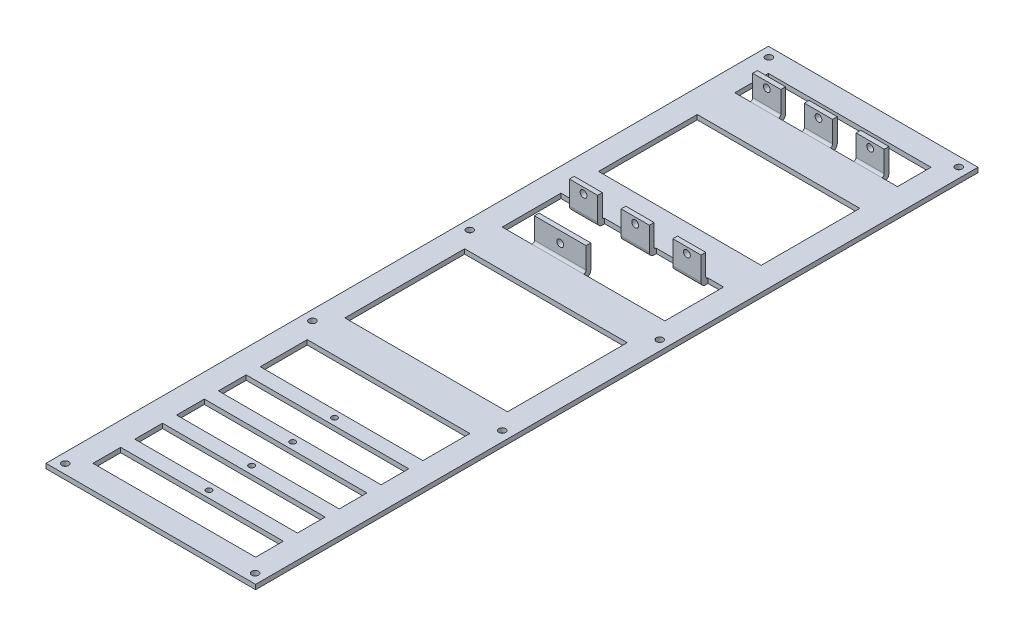
from build123d import *

# Parameters (mm, degrees)
SKETCH1_W                      = 89.225
SKETCH1_H                      = 307.5
SKETCH1_W_2                    = 69.225
SKETCH1_H_2                    = 42
SKETCH1_H_3                    = 20
SKETCH1_H_4                    = 51
SKETCH1_H_5                    = 14.3
SKETCH1_H_6                    = 25
BOSS_EXTRUDE1_DEPTH            = 2
SKETCH20_W                     = 22
SKETCH20_H                     = 1
BOSS_EXTRUDE7_DEPTH            = 2
SKETCH21_W                     = 22
SKETCH21_H                     = 2
BOSS_EXTRUDE8_DEPTH            = 12
FILLET7_R                      = 2
FILLET8_R                      = 1
M2_5_CLEARANCE_HOLE3_D         = 2.9
SKETCH28_W                     = 12
SKETCH28_H                     = 1
BOSS_EXTRUDE11_DEPTH           = 2
SKETCH29_W                     = 12
SKETCH29_H                     = 2
BOSS_EXTRUDE12_DEPTH           = 12
FILLET11_R                     = 2
FILLET12_R                     = 1
M2_5_START                     = -286.2
M2_5_CLEARANCE_HOLE5_OUTLINE_R = 1.45
M2_5_CLEARANCE_HOLE5_DEPTH     = 80
M2_5_CLEARANCE_HOLE6_D         = 2.9
M2_CLEARANCE_HOLE1_D           = 2.4


# Read off the part's stored shape, not the designer's step: M2.5 Clearance Hole5
with BuildPart() as part:
    # Sketch1 → Boss-Extrude1 (new body)
    with BuildSketch(Plane(origin=(0, 0, 0), x_dir=(1, 0, 0), z_dir=(0, 1, 0))):
        with Locations((44.6125, 153.75)):
            Rectangle(SKETCH1_W, SKETCH1_H)
        with Locations((44.6125, 246.2)):
            Rectangle(SKETCH1_W_2, SKETCH1_H_2, mode=Mode.SUBTRACT)
        Polygon((10, 10), (79.225, 10), (79.225, 21.8), (56.6125, 21.8), (32.6125, 21.8), (10, 21.8), align=None, mode=Mode.SUBTRACT)
        Polygon((10, 27.8), (79.225, 27.8), (79.225, 39.6), (56.6125, 39.6), (32.6125, 39.6), (10, 39.6), align=None, mode=Mode.SUBTRACT)
        Polygon((10, 45.6), (79.225, 45.6), (79.225, 57.4), (56.6125, 57.4), (32.6125, 57.4), (10, 57.4), align=None, mode=Mode.SUBTRACT)
        Polygon((10, 63.4), (79.225, 63.4), (79.225, 75.2), (56.6125, 75.2), (32.6125, 75.2), (10, 75.2), align=None, mode=Mode.SUBTRACT)
        with Locations((44.6125, 91.2)):
            Rectangle(SKETCH1_W_2, SKETCH1_H_3, mode=Mode.SUBTRACT)
        with Locations((44.6125, 142.7)):
            Rectangle(SKETCH1_W_2, SKETCH1_H_4, mode=Mode.SUBTRACT)
        with Locations((44.6125, 290.35)):
            Rectangle(SKETCH1_W_2, SKETCH1_H_5, mode=Mode.SUBTRACT)
        with Locations((44.6125, 196.7)):
            Rectangle(SKETCH1_W_2, SKETCH1_H_6, mode=Mode.SUBTRACT)
    extrude(amount=BOSS_EXTRUDE1_DEPTH)

    # Sketch20 → Boss-Extrude7 (add)
    with BuildSketch(Plane(origin=(0, 0, 0), x_dir=(1, 0, 0), z_dir=(0, 1, 0))):
        with Locations((33.7, 184.7)):
            Rectangle(SKETCH20_W, SKETCH20_H)
    extrude(amount=BOSS_EXTRUDE7_DEPTH)

    # Sketch21 → Boss-Extrude8 (add)
    with BuildSketch(Plane(origin=(0, 0, 0), x_dir=(1, 0, 0), z_dir=(0, 1, 0))):
        with Locations((33.7, 186.2)):
            Rectangle(SKETCH21_W, SKETCH21_H)
    extrude(amount=BOSS_EXTRUDE8_DEPTH)

    # Fillet7
    fillet7_edges = [part.edges().sort_by_distance(p)[0] for p in [
        (33.7, 0, -187.2),
    ]]
    fillet(fillet7_edges, radius=FILLET7_R)

    # Fillet8
    fillet8_edges = [part.edges().sort_by_distance(p)[0] for p in [
        (33.7, 2, -185.2),
    ]]
    fillet(fillet8_edges, radius=FILLET8_R)

    # M2.5 Clearance Hole3 (through all)
    with Locations(Plane.XY.offset(-185.2)):
        with Locations((33.7, 7.4125)):
            Hole(M2_5_CLEARANCE_HOLE3_D / 2)

    # Sketch28 → Boss-Extrude11 (add)
    with BuildSketch(Plane(origin=(0, 0, 0), x_dir=(1, 0, 0), z_dir=(0, 1, 0))):
        with Locations((66.6125, 208.7)):
            Rectangle(SKETCH28_W, SKETCH28_H)
        with Locations((44.6125, 208.7)):
            Rectangle(SKETCH28_W, SKETCH28_H)
        with Locations((22.6125, 208.7)):
            Rectangle(SKETCH28_W, SKETCH28_H)
        with Locations((66.6125, 283.7)):
            Rectangle(SKETCH28_W, SKETCH28_H)
        with Locations((44.6125, 283.7)):
            Rectangle(SKETCH28_W, SKETCH28_H)
        with Locations((22.6125, 283.7)):
            Rectangle(SKETCH28_W, SKETCH28_H)
    extrude(amount=BOSS_EXTRUDE11_DEPTH)

    # Sketch29 → Boss-Extrude12 (add)
    with BuildSketch(Plane(origin=(0, 0, 0), x_dir=(1, 0, 0), z_dir=(0, 1, 0))):
        with Locations((66.6125, 207.2)):
            Rectangle(SKETCH29_W, SKETCH29_H)
        with Locations((44.6125, 207.2)):
            Rectangle(SKETCH29_W, SKETCH29_H)
        with Locations((22.6125, 207.2)):
            Rectangle(SKETCH29_W, SKETCH29_H)
        with Locations((66.6125, 285.2)):
            Rectangle(SKETCH29_W, SKETCH29_H)
        with Locations((44.6125, 285.2)):
            Rectangle(SKETCH29_W, SKETCH29_H)
        with Locations((22.6125, 285.2)):
            Rectangle(SKETCH29_W, SKETCH29_H)
    extrude(amount=BOSS_EXTRUDE12_DEPTH)

    # Fillet11
    fillet11_edges = [part.edges().sort_by_distance(p)[0] for p in [
        (66.6125, 0, -206.2),
        (44.6125, 0, -206.2),
        (22.6125, 0, -206.2),
        (66.6125, 0, -286.2),
        (44.6125, 0, -286.2),
        (22.6125, 0, -286.2),
    ]]
    fillet(fillet11_edges, radius=FILLET11_R)

    # Fillet12
    fillet12_edges = [part.edges().sort_by_distance(p)[0] for p in [
        (22.6125, 2, -284.2),
        (44.6125, 2, -284.2),
        (66.6125, 2, -284.2),
        (66.6125, 2, -208.2),
        (44.6125, 2, -208.2),
        (22.6125, 2, -208.2),
    ]]
    fillet(fillet12_edges, radius=FILLET12_R)

    # M2.5 Clearance Hole5 outline → M2.5 Clearance Hole5 (cut)
    with BuildSketch(Plane.XY.offset(M2_5_START)):
        with Locations((22.6125, 9.5)):
            Circle(M2_5_CLEARANCE_HOLE5_OUTLINE_R)
        with Locations((44.6125, 9.5)):
            Circle(M2_5_CLEARANCE_HOLE5_OUTLINE_R)
        with Locations((66.6125, 9.5)):
            Circle(M2_5_CLEARANCE_HOLE5_OUTLINE_R)
    extrude(amount=M2_5_CLEARANCE_HOLE5_DEPTH, mode=Mode.SUBTRACT)

    # M2.5 Clearance Hole6 (through all)
    with Locations(Plane(origin=(0, 2, 0), x_dir=(1, 0, 0), z_dir=(0, 1, 0))):
        with Locations((85.025, 4), (4.2, 4), (4.2, 109.2), (4.2, 176.2), (4.2, 303.5), (85.025, 303.5), (85.025, 176.2), (85.025, 109.2)):
            Hole(M2_5_CLEARANCE_HOLE6_D / 2)

    # M2 Clearance Hole1 (through all)
    with Locations(Plane(origin=(0, 0, 0), x_dir=(-1, 0, 0), z_dir=(0, -1, 0))):
        with Locations((-44.6125, 24.8), (-44.6125, 42.9), (-44.6125, 60.4), (-44.6125, 78.2)):
            Hole(M2_CLEARANCE_HOLE1_D / 2)


solid = part.part
